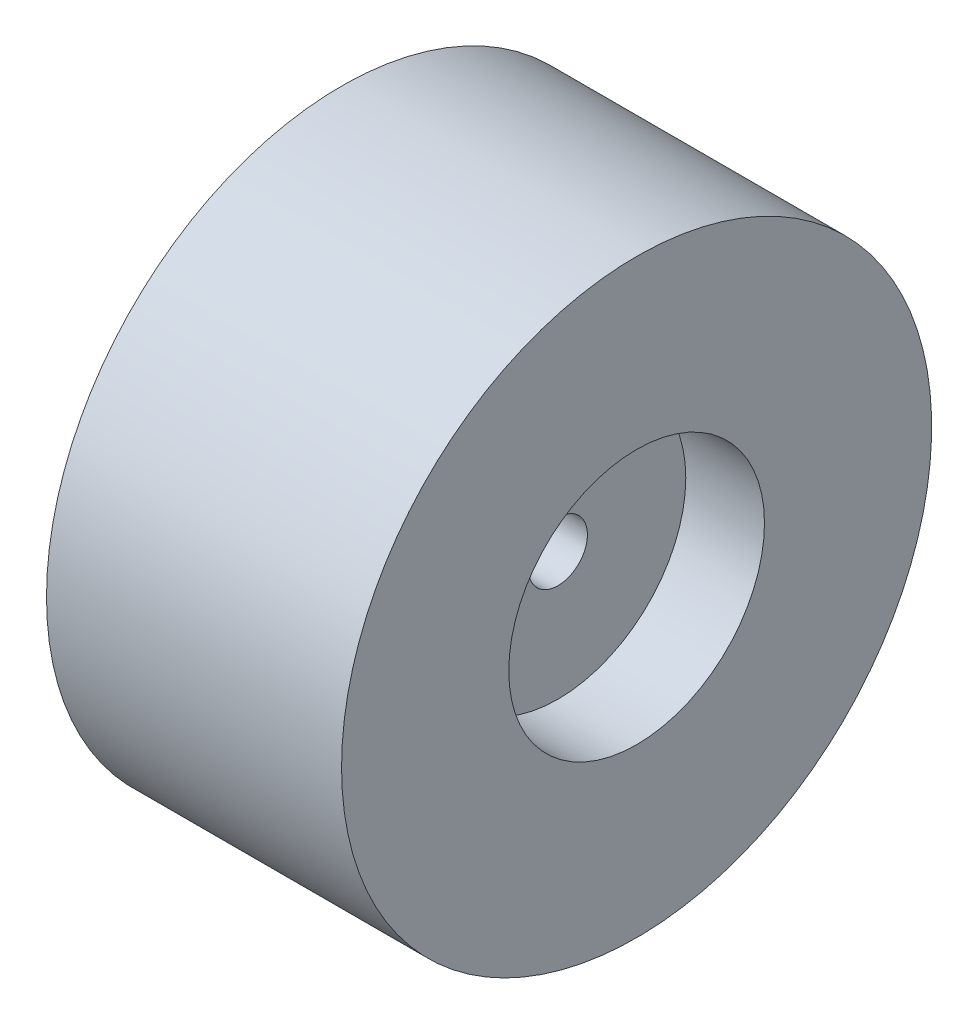
from build123d import *


with BuildPart() as part:
    # Эскиз4 → Повернуть1 (revolve)
    with BuildSketch(Plane.XY):
        Polygon((-30, 30), (-30, 25.082903769), (-28, 23.082903769), (-14, 15), (-14, 3), (-8, 3), (-8, 13), (0, 13), (0, 30), align=None)
    revolve(axis=Axis((-30, 0, 0), (1, 0, 0)))


solid = part.part
